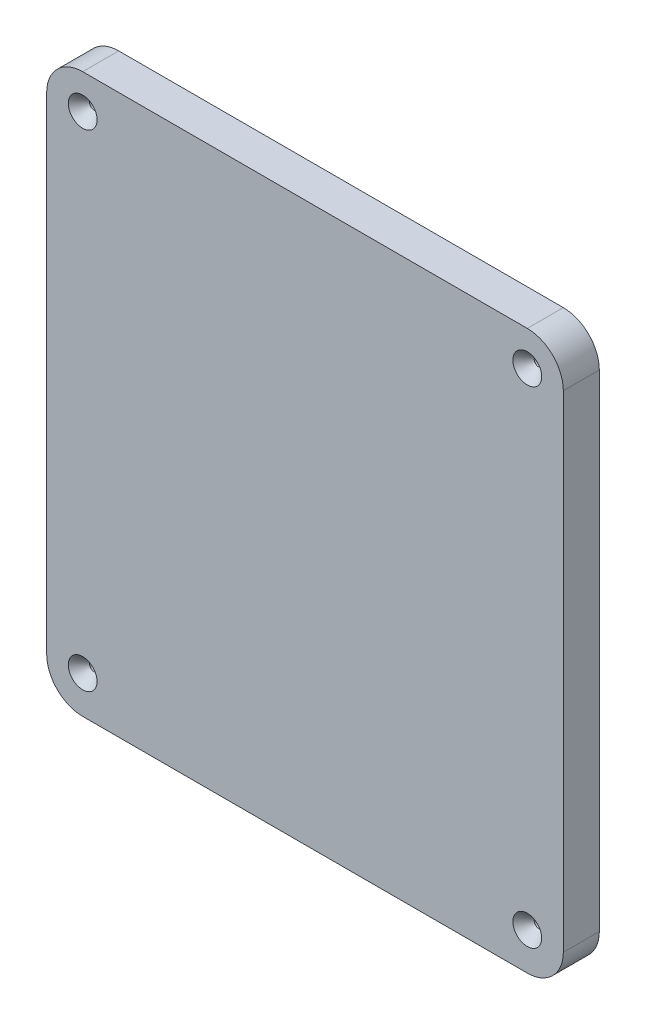
from build123d import *

# Parameters (mm, degrees)
SKETCH1_W           = 182.149999994
SKETCH1_H           = 196.85
BOSS_EXTRUDE1_DEPTH = 12.7
FILLET1_R           = 12.7
HOLE1_D             = 3.175
HOLE1_DEPTH         = 31.75
HOLE1_CSINK_D       = 10.16
HOLE1_CSINK_ANGLE   = 82
HOLE1_TIP           = 0.953866233


with BuildPart() as part:
    # Sketch1 → Boss-Extrude1 (new body)
    with BuildSketch(Plane.XY):
        with Locations((47.975000003, 766.50216301)):
            Rectangle(SKETCH1_W, SKETCH1_H)
    extrude(amount=BOSS_EXTRUDE1_DEPTH)

    # Fillet1
    fillet1_edges = [part.edges().sort_by_distance(p)[0] for p in [
        (139.05, 864.92716301, 6.35),
        (139.05, 668.07716301, 6.35),
        (-43.099999994, 668.07716301, 6.35),
        (-43.099999994, 864.92716301, 6.35),
    ]]
    fillet(fillet1_edges, radius=FILLET1_R)

    # Hole1
    with Locations(Plane(origin=(47.975000003, -440.307607432, 12.7), x_dir=(1, 0, 0), z_dir=(0, 0, 1))):
        with Locations((-78.374999997, 1293.039195846), (-78.374999997, 1121.589195846), (78.374999997, 1121.589195846), (78.374999997, 1293.039195846), (-764.015524801, 1530.078195669)):
            CounterSinkHole(HOLE1_D / 2, HOLE1_CSINK_D / 2, depth=HOLE1_DEPTH, counter_sink_angle=HOLE1_CSINK_ANGLE)
            with Locations((0, 0, -(HOLE1_DEPTH + HOLE1_TIP / 2))):  # 118° drill point
                Cone(0, HOLE1_D / 2, HOLE1_TIP, mode=Mode.SUBTRACT)


solid = part.part
